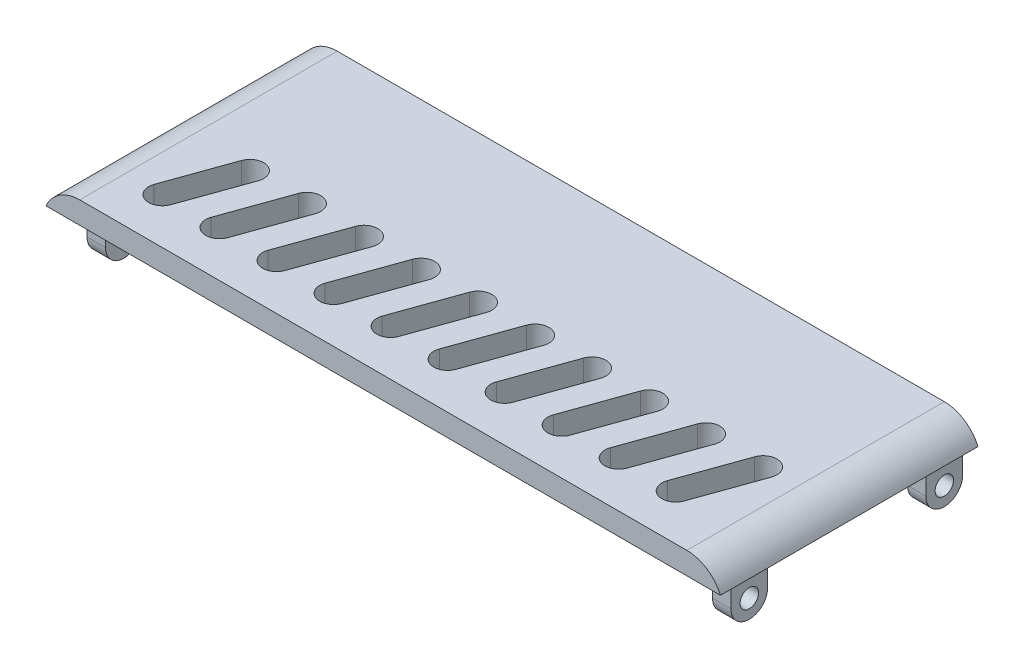
from build123d import *
from OCP.BRepFilletAPI import BRepFilletAPI_MakeChamfer

# Parameters (mm, degrees)
SKETCH_2_W                    = 74
SKETCH_2_H                    = 28
EXTRUDE_1_DEPTH               = 4
FILLET_1_R                    = 4
SKETCH_3_W                    = 74
SKETCH_3_H                    = 1.6
CUT_EXTRUDE_1_DEPTH           = 52.395634348
CUT_EXTRUDE_6_REACH           = 47.254
SKETCH_21_W                   = 10
SKETCH_21_H                   = 2
SKETCH_21_W_2                 = 12
EXTRUDE_9_DEPTH               = 0.15
SKETCH_22_W                   = 2
SKETCH_22_H                   = 4
EXTRUDE_10_DEPTH              = 5.5
FILLET_3_R                    = 2
SKETCH_23_R                   = 1
CUT_EXTRUDE_8_DEPTH           = 2
CUT_EXTRUDE_8_DRAFT           = -2
CUT_EXTRUDE_8_PROFILE_2_DEPTH = 2
CUT_EXTRUDE_8_PROFILE_2_DRAFT = -2
SKETCH_24_R                   = 1
CUT_EXTRUDE_9_DEPTH           = 2
CUT_EXTRUDE_9_DRAFT           = -2
CUT_EXTRUDE_9_PROFILE_2_DEPTH = 2
CUT_EXTRUDE_9_PROFILE_2_DRAFT = -2
SKETCH_25_W                   = 6
SKETCH_25_H                   = 1.2
SKETCH_25_W_2                 = 4
EXTRUDE_11_DEPTH              = 3
CHAMFER_1_SIZE                = 1
CHAMFER_1_SIZE2               = 0.649407593


with BuildPart() as part:
    # 草图2 → 凸台-拉伸1 (new body)
    with BuildSketch(Plane(origin=(0, 0, 0), x_dir=(1, 0, 0), z_dir=(0, 1, 0))):
        with Locations((5.91283293, 1.140435835)):
            Rectangle(SKETCH_2_W, SKETCH_2_H)
    extrude(amount=EXTRUDE_1_DEPTH)

    # 圆角1
    fillet_1_edges = [part.edges().sort_by_distance(p)[0] for p in [
        (-31.08716707, 4, -1.140435835),
        (42.91283293, 4, -1.140435835),
    ]]
    fillet(fillet_1_edges, radius=FILLET_1_R - 0.0001)  # a hair under: the kernel refuses the full size

    # 草图3 → 切除-拉伸1 (cut, through all)
    with BuildSketch(Plane(origin=(0, 0, -15.140435835), x_dir=(-1, 0, 0), z_dir=(0, 0, -1))):
        with Locations((-5.91283293, 0.8)):
            Rectangle(SKETCH_3_W, SKETCH_3_H)
    extrude(amount=-CUT_EXTRUDE_1_DEPTH, mode=Mode.SUBTRACT)

    # 草图19 → 切除-拉伸6 (cut, up to next)
    with BuildSketch(Plane(origin=(0, 4, 0), x_dir=(1, 0, 0), z_dir=(0, 1, 0)), mode=Mode.PRIVATE) as cut_extrude_6_sk1:
        with BuildLine():
            Line((-19.174554203, -1.36406876), (-21.674554203, -8.36406876))
            ThreePointArc((-21.674554203, -8.36406876), (-23.591671666, -9.272177032), (-24.499779938, -7.355059569))
            Line((-24.499779938, -7.355059569), (-21.999779938, -0.355059569))
            ThreePointArc((-21.999779938, -0.355059569), (-20.082662475, 0.553048703), (-19.174554203, -1.36406876))
        make_face()
    cut_extrude_6_tool1 = extrude(cut_extrude_6_sk1.sketch, amount=-CUT_EXTRUDE_6_REACH, mode=Mode.PRIVATE) & part.part
    # 草图19 → 切除-拉伸6 (cut, up to next)
    with BuildSketch(Plane(origin=(0, 4, 0), x_dir=(1, 0, 0), z_dir=(0, 1, 0)), mode=Mode.PRIVATE) as cut_extrude_6_sk2:
        with BuildLine():
            Line((-12.974554203, -1.36406876), (-15.474554203, -8.36406876))
            ThreePointArc((-15.474554203, -8.36406876), (-17.391671666, -9.272177032), (-18.299779938, -7.355059569))
            Line((-18.299779938, -7.355059569), (-15.799779938, -0.355059569))
            ThreePointArc((-15.799779938, -0.355059569), (-13.882662475, 0.553048703), (-12.974554203, -1.36406876))
        make_face()
    cut_extrude_6_tool2 = extrude(cut_extrude_6_sk2.sketch, amount=-CUT_EXTRUDE_6_REACH, mode=Mode.PRIVATE) & part.part
    # 草图19 → 切除-拉伸6 (cut, up to next)
    with BuildSketch(Plane(origin=(0, 4, 0), x_dir=(1, 0, 0), z_dir=(0, 1, 0)), mode=Mode.PRIVATE) as cut_extrude_6_sk3:
        with BuildLine():
            Line((-6.774554203, -1.36406876), (-9.274554203, -8.36406876))
            ThreePointArc((-9.274554203, -8.36406876), (-11.191671666, -9.272177032), (-12.099779938, -7.355059569))
            Line((-12.099779938, -7.355059569), (-9.599779938, -0.355059569))
            ThreePointArc((-9.599779938, -0.355059569), (-7.682662475, 0.553048703), (-6.774554203, -1.36406876))
        make_face()
    cut_extrude_6_tool3 = extrude(cut_extrude_6_sk3.sketch, amount=-CUT_EXTRUDE_6_REACH, mode=Mode.PRIVATE) & part.part
    # 草图19 → 切除-拉伸6 (cut, up to next)
    with BuildSketch(Plane(origin=(0, 4, 0), x_dir=(1, 0, 0), z_dir=(0, 1, 0)), mode=Mode.PRIVATE) as cut_extrude_6_sk4:
        with BuildLine():
            Line((-0.574554203, -1.36406876), (-3.074554203, -8.36406876))
            ThreePointArc((-3.074554203, -8.36406876), (-4.991671666, -9.272177032), (-5.899779938, -7.355059569))
            Line((-5.899779938, -7.355059569), (-3.399779938, -0.355059569))
            ThreePointArc((-3.399779938, -0.355059569), (-1.482662475, 0.553048703), (-0.574554203, -1.36406876))
        make_face()
    cut_extrude_6_tool4 = extrude(cut_extrude_6_sk4.sketch, amount=-CUT_EXTRUDE_6_REACH, mode=Mode.PRIVATE) & part.part
    # 草图19 → 切除-拉伸6 (cut, up to next)
    with BuildSketch(Plane(origin=(0, 4, 0), x_dir=(1, 0, 0), z_dir=(0, 1, 0)), mode=Mode.PRIVATE) as cut_extrude_6_sk5:
        with BuildLine():
            Line((5.625445797, -1.36406876), (3.125445797, -8.36406876))
            ThreePointArc((3.125445797, -8.36406876), (1.208328334, -9.272177032), (0.300220062, -7.355059569))
            Line((0.300220062, -7.355059569), (2.800220062, -0.355059569))
            ThreePointArc((2.800220062, -0.355059569), (4.717337525, 0.553048703), (5.625445797, -1.36406876))
        make_face()
    cut_extrude_6_tool5 = extrude(cut_extrude_6_sk5.sketch, amount=-CUT_EXTRUDE_6_REACH, mode=Mode.PRIVATE) & part.part
    # 草图19 → 切除-拉伸6 (cut, up to next)
    with BuildSketch(Plane(origin=(0, 4, 0), x_dir=(1, 0, 0), z_dir=(0, 1, 0)), mode=Mode.PRIVATE) as cut_extrude_6_sk6:
        with BuildLine():
            Line((11.825445797, -1.36406876), (9.325445797, -8.36406876))
            ThreePointArc((9.325445797, -8.36406876), (7.408328334, -9.272177032), (6.500220062, -7.355059569))
            Line((6.500220062, -7.355059569), (9.000220062, -0.355059569))
            ThreePointArc((9.000220062, -0.355059569), (10.917337525, 0.553048703), (11.825445797, -1.36406876))
        make_face()
    cut_extrude_6_tool6 = extrude(cut_extrude_6_sk6.sketch, amount=-CUT_EXTRUDE_6_REACH, mode=Mode.PRIVATE) & part.part
    # 草图19 → 切除-拉伸6 (cut, up to next)
    with BuildSketch(Plane(origin=(0, 4, 0), x_dir=(1, 0, 0), z_dir=(0, 1, 0)), mode=Mode.PRIVATE) as cut_extrude_6_sk7:
        with BuildLine():
            Line((18.025445797, -1.36406876), (15.525445797, -8.36406876))
            ThreePointArc((15.525445797, -8.36406876), (13.608328334, -9.272177032), (12.700220062, -7.355059569))
            Line((12.700220062, -7.355059569), (15.200220062, -0.355059569))
            ThreePointArc((15.200220062, -0.355059569), (17.117337525, 0.553048703), (18.025445797, -1.36406876))
        make_face()
    cut_extrude_6_tool7 = extrude(cut_extrude_6_sk7.sketch, amount=-CUT_EXTRUDE_6_REACH, mode=Mode.PRIVATE) & part.part
    # 草图19 → 切除-拉伸6 (cut, up to next)
    with BuildSketch(Plane(origin=(0, 4, 0), x_dir=(1, 0, 0), z_dir=(0, 1, 0)), mode=Mode.PRIVATE) as cut_extrude_6_sk8:
        with BuildLine():
            Line((24.225445797, -1.36406876), (21.725445797, -8.36406876))
            ThreePointArc((21.725445797, -8.36406876), (19.808328334, -9.272177032), (18.900220062, -7.355059569))
            Line((18.900220062, -7.355059569), (21.400220062, -0.355059569))
            ThreePointArc((21.400220062, -0.355059569), (23.317337525, 0.553048703), (24.225445797, -1.36406876))
        make_face()
    cut_extrude_6_tool8 = extrude(cut_extrude_6_sk8.sketch, amount=-CUT_EXTRUDE_6_REACH, mode=Mode.PRIVATE) & part.part
    # 草图19 → 切除-拉伸6 (cut, up to next)
    with BuildSketch(Plane(origin=(0, 4, 0), x_dir=(1, 0, 0), z_dir=(0, 1, 0)), mode=Mode.PRIVATE) as cut_extrude_6_sk9:
        with BuildLine():
            Line((30.425445797, -1.36406876), (27.925445797, -8.36406876))
            ThreePointArc((27.925445797, -8.36406876), (26.008328334, -9.272177032), (25.100220062, -7.355059569))
            Line((25.100220062, -7.355059569), (27.600220062, -0.355059569))
            ThreePointArc((27.600220062, -0.355059569), (29.517337525, 0.553048703), (30.425445797, -1.36406876))
        make_face()
    cut_extrude_6_tool9 = extrude(cut_extrude_6_sk9.sketch, amount=-CUT_EXTRUDE_6_REACH, mode=Mode.PRIVATE) & part.part
    # 草图19 → 切除-拉伸6 (cut, up to next)
    with BuildSketch(Plane(origin=(0, 4, 0), x_dir=(1, 0, 0), z_dir=(0, 1, 0)), mode=Mode.PRIVATE) as cut_extrude_6_sk10:
        with BuildLine():
            Line((36.625445797, -1.36406876), (34.125445797, -8.36406876))
            ThreePointArc((34.125445797, -8.36406876), (32.208328334, -9.272177032), (31.300220062, -7.355059569))
            Line((31.300220062, -7.355059569), (33.800220062, -0.355059569))
            ThreePointArc((33.800220062, -0.355059569), (35.717337525, 0.553048703), (36.625445797, -1.36406876))
        make_face()
    cut_extrude_6_tool10 = extrude(cut_extrude_6_sk10.sketch, amount=-CUT_EXTRUDE_6_REACH, mode=Mode.PRIVATE) & part.part
    add(cut_extrude_6_tool1.solids().sort_by_distance((-21.837167, 4, 4.359564))[0], mode=Mode.SUBTRACT)
    add(cut_extrude_6_tool2.solids().sort_by_distance((-15.637167, 4, 4.359564))[0], mode=Mode.SUBTRACT)
    add(cut_extrude_6_tool3.solids().sort_by_distance((-9.437167, 4, 4.359564))[0], mode=Mode.SUBTRACT)
    add(cut_extrude_6_tool4.solids().sort_by_distance((-3.237167, 4, 4.359564))[0], mode=Mode.SUBTRACT)
    add(cut_extrude_6_tool5.solids().sort_by_distance((2.962833, 4, 4.359564))[0], mode=Mode.SUBTRACT)
    add(cut_extrude_6_tool6.solids().sort_by_distance((9.162833, 4, 4.359564))[0], mode=Mode.SUBTRACT)
    add(cut_extrude_6_tool7.solids().sort_by_distance((15.362833, 4, 4.359564))[0], mode=Mode.SUBTRACT)
    add(cut_extrude_6_tool8.solids().sort_by_distance((21.562833, 4, 4.359564))[0], mode=Mode.SUBTRACT)
    add(cut_extrude_6_tool9.solids().sort_by_distance((27.762833, 4, 4.359564))[0], mode=Mode.SUBTRACT)
    add(cut_extrude_6_tool10.solids().sort_by_distance((33.962833, 4, 4.359564))[0], mode=Mode.SUBTRACT)

    # 草图21 → 凸台-拉伸9 (add)
    with BuildSketch(Plane.XZ.offset(-1.6)):
        with Locations((-17.753227626, 11.059564165)):
            Rectangle(SKETCH_21_W, SKETCH_21_H)
        with Locations((24.578893486, 11.059564165)):
            Rectangle(SKETCH_21_W_2, SKETCH_21_H)
    extrude(amount=EXTRUDE_9_DEPTH)

    # 草图22 → 凸台-拉伸10 (add)
    with BuildSketch(Plane.XZ.offset(-1.6)):
        with Locations((-28.08716707, 8.059564165)):
            Rectangle(SKETCH_22_W, SKETCH_22_H)
        with Locations((-28.08716707, -13.140435835)):
            Rectangle(SKETCH_22_W, SKETCH_22_H)
        with Locations((39.91283293, 8.059564165)):
            Rectangle(SKETCH_22_W, SKETCH_22_H)
        with Locations((39.91283293, -13.140435835)):
            Rectangle(SKETCH_22_W, SKETCH_22_H)
    extrude(amount=EXTRUDE_10_DEPTH)

    # 圆角3
    fillet_3_edges = [part.edges().sort_by_distance(p)[0] for p in [
        (-28.08716707, -3.9, -15.140435835),
        (-28.08716707, -3.9, -11.140435835),
        (-28.08716707, -3.9, 6.059564165),
        (-28.08716707, -3.9, 10.059564165),
        (39.91283293, -3.9, -11.140435835),
        (39.91283293, -3.9, -15.140435835),
        (39.91283293, -3.9, 6.059564165),
        (39.91283293, -3.9, 10.059564165),
    ]]
    fillet(fillet_3_edges, radius=FILLET_3_R - 0.0001)  # a hair under: the kernel refuses the full size


with BuildPart() as cut_extrude_8_tool:
    # 草图23 → 切除-拉伸8 (with draft: the straight prism first)
    with BuildSketch(Plane.ZY.offset(29.08716707)):
        with Locations((8.059564165, -1.9)):
            Circle(SKETCH_23_R)
    extrude(amount=-CUT_EXTRUDE_8_DEPTH)
    # 切除-拉伸8: the draft: its side faces are tilted about the plane it starts from
    cut_extrude_8_sides = [cut_extrude_8_tool.faces().sort_by_distance(p)[0] for p in [
        (-28.08716707, -1.9, 7.059564165),
    ]]
    draft(cut_extrude_8_sides, Plane.ZY.offset(29.08716707), CUT_EXTRUDE_8_DRAFT)


with BuildPart() as part_1:
    add(part.part)

    # 切除-拉伸8: cut by cut_extrude_8_tool
    add(cut_extrude_8_tool.part, mode=Mode.SUBTRACT)


with BuildPart() as cut_extrude_8_profile_2_tool:
    # 草图23 → 切除-拉伸8 profile 2 (with draft: the straight prism first)
    with BuildSketch(Plane.ZY.offset(29.08716707)):
        with Locations((-13.140435835, -1.9)):
            Circle(SKETCH_23_R)
    extrude(amount=-CUT_EXTRUDE_8_PROFILE_2_DEPTH)
    # 切除-拉伸8 profile 2: the draft: its side faces are tilted about the plane it starts from
    cut_extrude_8_profile_2_sides = [cut_extrude_8_profile_2_tool.faces().sort_by_distance(p)[0] for p in [
        (-28.08716707, -1.9, -14.140435835),
    ]]
    draft(cut_extrude_8_profile_2_sides, Plane.ZY.offset(29.08716707), CUT_EXTRUDE_8_PROFILE_2_DRAFT)


with BuildPart() as part_2:
    add(part_1.part)

    # 切除-拉伸8 profile 2: cut by cut_extrude_8_profile_2_tool
    add(cut_extrude_8_profile_2_tool.part, mode=Mode.SUBTRACT)


with BuildPart() as cut_extrude_9_tool:
    # 草图24 → 切除-拉伸9 (with draft: the straight prism first)
    with BuildSketch(Plane(origin=(40.91283293, 0, 0), x_dir=(0, 0, -1), z_dir=(1, 0, 0))):
        with Locations((13.140435835, -1.9)):
            Circle(SKETCH_24_R)
    extrude(amount=-CUT_EXTRUDE_9_DEPTH)
    # 切除-拉伸9: the draft: its side faces are tilted about the plane it starts from
    cut_extrude_9_sides = [cut_extrude_9_tool.faces().sort_by_distance(p)[0] for p in [
        (39.91283293, -1.9, -12.140435835),
    ]]
    draft(cut_extrude_9_sides, Plane(origin=(40.91283293, 0, 0), x_dir=(0, 0, -1), z_dir=(1, 0, 0)), CUT_EXTRUDE_9_DRAFT)


with BuildPart() as part_3:
    add(part_2.part)

    # 切除-拉伸9: cut by cut_extrude_9_tool
    add(cut_extrude_9_tool.part, mode=Mode.SUBTRACT)


with BuildPart() as cut_extrude_9_profile_2_tool:
    # 草图24 → 切除-拉伸9 profile 2 (with draft: the straight prism first)
    with BuildSketch(Plane(origin=(40.91283293, 0, 0), x_dir=(0, 0, -1), z_dir=(1, 0, 0))):
        with Locations((-8.059564165, -1.9)):
            Circle(SKETCH_24_R)
    extrude(amount=-CUT_EXTRUDE_9_PROFILE_2_DEPTH)
    # 切除-拉伸9 profile 2: the draft: its side faces are tilted about the plane it starts from
    cut_extrude_9_profile_2_sides = [cut_extrude_9_profile_2_tool.faces().sort_by_distance(p)[0] for p in [
        (39.91283293, -1.9, 9.059564165),
    ]]
    draft(cut_extrude_9_profile_2_sides, Plane(origin=(40.91283293, 0, 0), x_dir=(0, 0, -1), z_dir=(1, 0, 0)), CUT_EXTRUDE_9_PROFILE_2_DRAFT)


with BuildPart() as part_4:
    add(part_3.part)

    # 切除-拉伸9 profile 2: cut by cut_extrude_9_profile_2_tool
    add(cut_extrude_9_profile_2_tool.part, mode=Mode.SUBTRACT)

    # 草图25 → 凸台-拉伸11 (add)
    with BuildSketch(Plane.XZ.offset(-1.6)):
        with Locations((-24.08716707, 9.459564165)):
            Rectangle(SKETCH_25_W, SKETCH_25_H)
        with Locations((36.91283293, 9.459564165)):
            Rectangle(SKETCH_25_W_2, SKETCH_25_H)
    extrude(amount=EXTRUDE_11_DEPTH)

    # 倒角1: one chamfer whose edges measure the first distance from different faces: ONE call of the kernel's chamfer builder (chamfer() names one face for all edges)
    chamfer_1_edges_1 = [part_4.edges().sort_by_distance(p)[0] for p in [
        (-24.08716707, -1.4, 10.059564165),
    ]]
    chamfer_1_side_1 = [part_4.faces().sort_by_distance(p)[0] for p in [
        (-25.240379593, 0.014889063, 10.059564165),
    ]]
    chamfer_1_edges_2 = [part_4.edges().sort_by_distance(p)[0] for p in [
        (36.91283293, -1.4, 10.059564165),
    ]]
    chamfer_1_side_2 = [part_4.faces().sort_by_distance(p)[0] for p in [
        (38.018116032, 0.007874653, 10.059564165),
    ]]
    chamfer_1 = BRepFilletAPI_MakeChamfer(part_4.part.solid().wrapped)
    for e in chamfer_1_edges_1:
        chamfer_1.Add(CHAMFER_1_SIZE, CHAMFER_1_SIZE2, e.wrapped, chamfer_1_side_1[0].wrapped)  # the first distance lies on this face
    for e in chamfer_1_edges_2:
        chamfer_1.Add(CHAMFER_1_SIZE, CHAMFER_1_SIZE2, e.wrapped, chamfer_1_side_2[0].wrapped)  # the first distance lies on this face
    add(Compound.cast(chamfer_1.Shape()), mode=Mode.REPLACE)


solid = part_4.part
